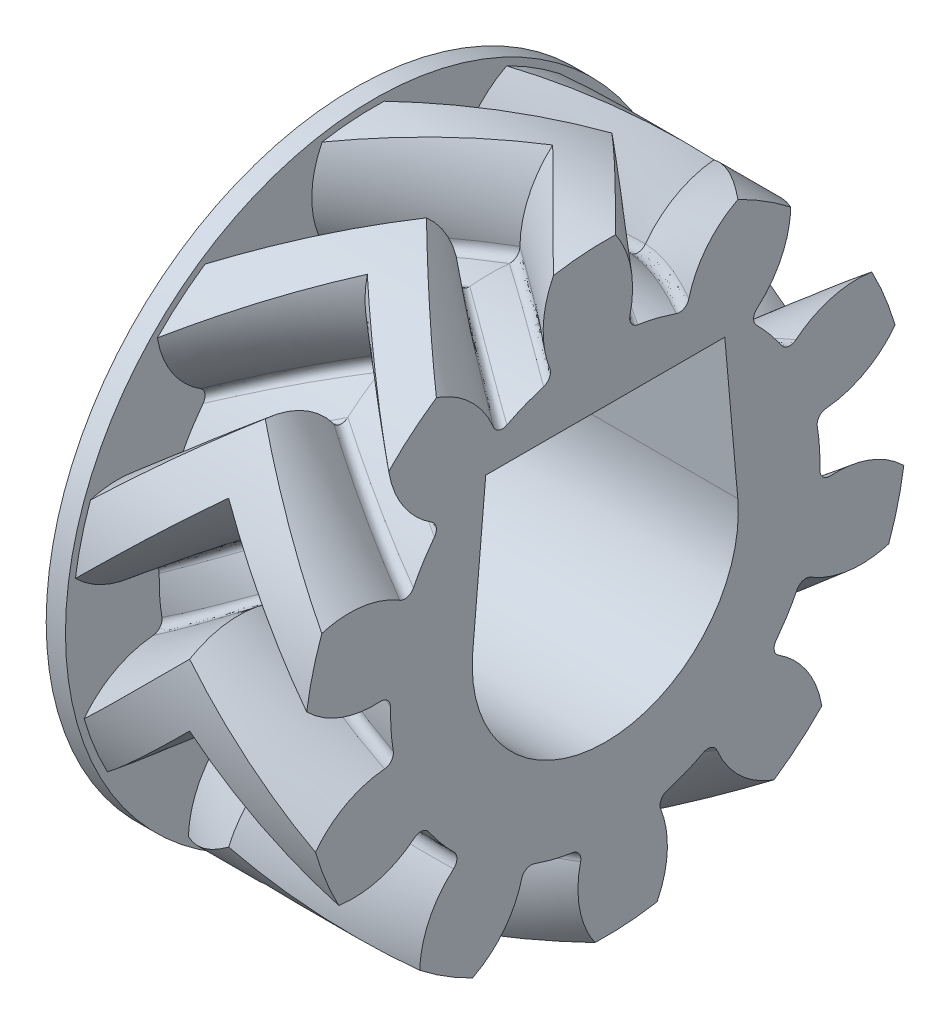
from build123d import *

# Parameters (mm, degrees)
BASPROSKE_W         = 3
BASPROSKE_H         = 7.821067812
TOOTHCUTRH_PITCH    = 49.141218362
TEETHCUTSRH_COUNT   = 10
TEETHCUTSRH_ANGLE   = 324
BORSKE_R            = 2
BORE_DEPTH          = 62.5000025
SKETCH_3_R          = 8
SKETCH_3_R_2        = 2
EXTRUDE_1_DEPTH     = 0.5
SKETCH_1_R          = 3.45
CUT_EXTRUDE_1_DEPTH = 14.047988473
CUT_EXTRUDE_2_DEPTH = 4.5


with BuildPart() as part:
    # BasProSke → Base-Revolve (revolve)
    with BuildSketch(Plane(origin=(0, 0, 0), x_dir=(1, 0, 0), z_dir=(0, 1, 0)), mode=Mode.PRIVATE) as base_revolve_sk:
        with Locations((1.5, 3.910533906)):
            Rectangle(BASPROSKE_W, BASPROSKE_H)
    revolve(base_revolve_sk.sketch.rotate(Axis((-10, 0, 0), (1, 0, 0)), 180), axis=Axis((-10, 0, 0), (1, 0, 0)))

    # ToothCutRH: the profile of TooCutSkeRH screwed along a right-hand helix of 0.061049 turns, 26 arcs to a turn; built about Z, then put on its axis
    toothcutrh_z = Axis((0, 0, 0), (0, 0, 1))
    toothcutrh_corners = [(5.54740917, -0.512882118, 0), (5.54740917, 0.512882118, 0), (5.611043231, 0.704195745, 0), (5.794883836, 0.786977562, 0), (7.834221117, 1.875974279, 0), (7.834221117, -1.875974279, 0), (5.794883836, -0.786977562, 0), (5.611043231, -0.704195745, 0)]
    with BuildLine(mode=Mode.PRIVATE) as toothcutrh_profile:
        ThreePointArc((5.54740917, -0.512882118, 0), (5.571067812, 0, 0), (5.54740917, 0.512882118, 0))
        ThreePointArc((5.54740917, 0.512882118, 0), (5.559172569, 0.615209099, 0), (5.611043231, 0.704195745, 0))
        ThreePointArc((5.611043231, 0.704195745, 0), (5.694286284, 0.764856957, 0), (5.794883836, 0.786977562, 0))
        ThreePointArc((5.794883836, 0.786977562, 0), (6.947994825, 1.081581727, 0), (7.834221117, 1.875974279, 0))
        ThreePointArc((7.834221117, 1.875974279, 0), (8.055699846, 0, 0), (7.834221117, -1.875974279, 0))
        ThreePointArc((7.834221117, -1.875974279, 0), (6.947994825, -1.081581727, 0), (5.794883836, -0.786977562, 0))
        ThreePointArc((5.794883836, -0.786977562, 0), (5.694286284, -0.764856957, 0), (5.611043231, -0.704195745, 0))
        ThreePointArc((5.611043231, -0.704195745, 0), (5.559172569, -0.615209099, 0), (5.54740917, -0.512882118, 0))
    toothcutrh_cap = Face(toothcutrh_profile.wire())
    toothcutrh_arcs = [((5.54740917, -0.512882118, 0), (5.594827354, 0, 0), (5.54740917, 0.512882118, 0), (1, 0.9957533020879911, 1)), ((5.54740917, 0.512882118, 0), (5.537275211, 0.622492521, 0), (5.611043231, 0.704195745, 0), (1, 0.915801426818008, 1)), ((5.611043231, 0.704195745, 0), (5.68481125, 0.785898968, 0), (5.794883836, 0.786977562, 0), (1, 0.915801426818008, 1)), ((5.794883836, 0.786977562, 0), (7.098490862, 0.799751513, 0), (7.834221117, 1.875974279, 0), (1, 0.8866834745538676, 1)), ((7.834221117, 1.875974279, 0), (8.283439929, 0, 0), (7.834221117, -1.875974279, 0), (1, 0.9725065812905824, 1)), ((7.834221117, -1.875974279, 0), (7.098490862, -0.799751513, 0), (5.794883836, -0.786977562, 0), (1, 0.8866834745538664, 1)), ((5.794883836, -0.786977562, 0), (5.68481125, -0.785898968, 0), (5.611043231, -0.704195745, 0), (1, 0.9158014268180066, 1)), ((5.611043231, -0.704195745, 0), (5.537275211, -0.622492521, 0), (5.54740917, -0.512882118, 0), (1, 0.9158014268180066, 1))]  # start, shoulder, end, weights
    toothcutrh_turn_angles = [0, 6.923076923, 13.846153846, 17.911815461, 21.977477075]
    toothcutrh_turn_weights = [1, 0.992708874098054, 1, 0.997483453494221, 1]
    toothcutrh_turn_sides = [Face.make_bezier_surface([[Vector(p[j][0], p[j][1], 0).rotate(toothcutrh_z, toothcutrh_turn_angles[2 * i + k]) / toothcutrh_turn_weights[2 * i + k] + Vector(0, 0, p[j][2] + TOOTHCUTRH_PITCH * toothcutrh_turn_angles[2 * i + k] / 360) for k in range(3)] for j in range(3)], [[p[3][j] * toothcutrh_turn_weights[2 * i + k] for k in range(3)] for j in range(3)]) for p in toothcutrh_arcs for i in range(2)]
    toothcutrh = Plane(origin=(0, 0, 0), x_dir=(0, 1, 0), z_dir=(1, 0, 0)) * Solid(Shell([*toothcutrh_turn_sides, toothcutrh_cap, toothcutrh_cap.rotate(toothcutrh_z, 21.977477075).moved(Location((0, 0, TOOTHCUTRH_PITCH * 21.977477075 / 360)))]))
    add(toothcutrh, mode=Mode.SUBTRACT)

    # TeethCutsRH: ToothCutRH ×10 about axis
    teethcutsrh_axis = Axis((-10, 0, 0), (1, 0, 0))
    for i in range(1, TEETHCUTSRH_COUNT):
        add(toothcutrh.rotate(teethcutsrh_axis, i * TEETHCUTSRH_ANGLE / (TEETHCUTSRH_COUNT - 1)), mode=Mode.SUBTRACT)

    # BorSke → Bore (cut, symmetric)
    with BuildSketch(Plane(origin=(0, 0, 0), x_dir=(0, 0, -1), z_dir=(1, 0, 0))):
        with Locations(Location((0, 0, 0), (0, 0, 180))):
            Circle(BORSKE_R)
    extrude(amount=BORE_DEPTH, both=True, mode=Mode.SUBTRACT)

    # 鏡射1: part across plane


with BuildPart() as part_1:
    add(part.part)
    add(part.part.mirror(Plane(origin=(0, 0, 0), x_dir=(0, 0, 1), z_dir=(1, 0, 0))))

    # 草圖3 → 填料-伸長1 (add)
    with BuildSketch(Plane.ZY.offset(3)):
        Circle(SKETCH_3_R)
        Circle(SKETCH_3_R_2, mode=Mode.SUBTRACT)
    extrude(amount=EXTRUDE_1_DEPTH)

    # 草圖1 → 除料-伸長1 (cut, through all)
    with BuildSketch(Plane.ZY.offset(-3)):
        Circle(SKETCH_1_R)
    extrude(amount=CUT_EXTRUDE_1_DEPTH, mode=Mode.SUBTRACT)

    # 草圖2 → 除料-伸長2 (cut)
    with BuildSketch(Plane(origin=(3, 0, 0), x_dir=(0, 0, -1), z_dir=(1, 0, 0))):
        Polygon((-3.436517742, 0.304706097), (-3.1, 4.1), (3.1, 4.1), (3.436517742, 0.304706097), (0, 0), align=None)
    extrude(amount=-CUT_EXTRUDE_2_DEPTH, mode=Mode.SUBTRACT)


solid = part_1.part
